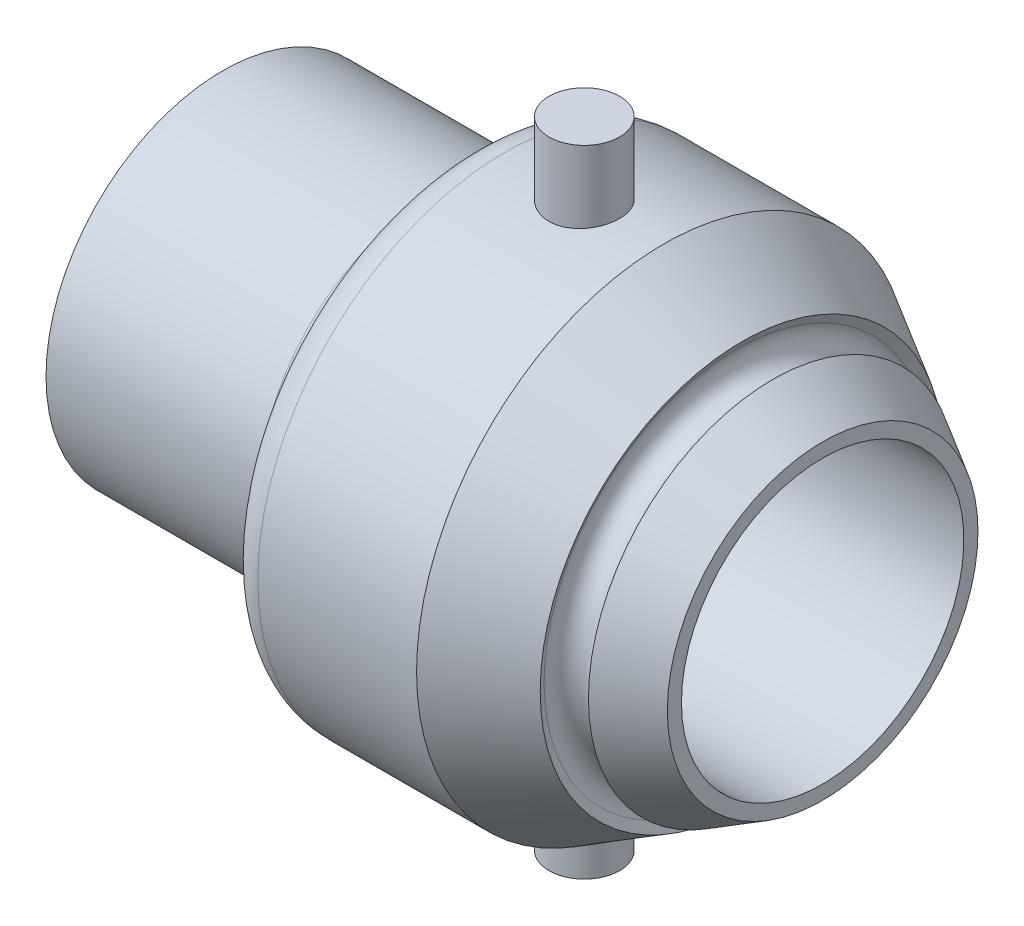
from build123d import *

# Parameters (mm, degrees)
SKETCH3_R                       = 25
SKETCH3_R_2                     = 20
BOSS_EXTRUDE2_DEPTH             = 35
FILLET1_R                       = 5
BOSS_EXTRUDE1_REACH             = 113.924
SKETCH2_R                       = 5
BOSS_EXTRUDE1_DIRECTION_2_DEPTH = 3


with BuildPart() as part:
    # Sketch1 → Revolve1 (revolve)
    with BuildSketch(Plane.XY, mode=Mode.PRIVATE) as revolve1_sk:
        with BuildLine():
            Line((-10.818024311, 35), (-38.301363812, 35))
            Line((-38.301363812, 35), (-38.301363812, 20))
            Line((-38.301363812, 20), (11.698636188, 20))
            Line((11.698636188, 20), (11.698636188, 22))
            Line((11.698636188, 22), (4.613699697, 26.09048999))
            Line((4.613699697, 26.09048999), (3.863699697, 24.791451884))
            ThreePointArc((3.863699697, 24.791451884), (0.448636188, 23.876388375), (-0.466427322, 27.291451884))
            Line((-0.466427322, 27.291451884), (0.283572678, 28.59048999))
            Line((0.283572678, 28.59048999), (-10.818024311, 35))
        make_face()
    revolve(revolve1_sk.sketch.rotate(Axis((-10.823091425, 0, 0), (1, 0, 0)), 90), axis=Axis((-10.823091425, 0, 0), (1, 0, 0)))

    # Sketch3 → Boss-Extrude2 (add)
    with BuildSketch(Plane.ZY.offset(38.301363812)):
        with Locations(Location((0, 0, 0), (0, 0, 180))):
            Circle(SKETCH3_R)
        Circle(SKETCH3_R_2, mode=Mode.SUBTRACT)
    extrude(amount=BOSS_EXTRUDE2_DEPTH)

    # Fillet1
    fillet1_edges = [part.edges().sort_by_distance(p)[0] for p in [
        (-38.301363812, 0, 25),
        (-38.301363812, 0, -35),
    ]]
    fillet(fillet1_edges, radius=FILLET1_R - 0.0001)  # a hair under: the kernel refuses the full size

    # Sketch2 → Boss-Extrude1 (add, up to next)
    with BuildSketch(Plane(origin=(0, 42, 0), x_dir=(1, 0, 0), z_dir=(0, 1, 0)), mode=Mode.PRIVATE) as boss_extrude1_sk1:
        with Locations(Location((-22.059694062, 0, 0), (0, 0, 90))):
            Circle(SKETCH2_R)
    boss_extrude1_tool1 = extrude(boss_extrude1_sk1.sketch, amount=-BOSS_EXTRUDE1_REACH, mode=Mode.PRIVATE) - part.part
    boss_extrude1 = boss_extrude1_tool1.solids().sort_by_distance((-22.059694, 42, 0))[0]
    add(boss_extrude1)

    # Sketch2 → Boss-Extrude1 direction 2 (add)
    with BuildSketch(Plane(origin=(0, 42, 0), x_dir=(1, 0, 0), z_dir=(0, 1, 0))):
        with Locations(Location((-22.059694062, 0, 0), (0, 0, 90))):
            Circle(SKETCH2_R)
    boss_extrude1_direction_2 = extrude(amount=BOSS_EXTRUDE1_DIRECTION_2_DEPTH)

    # Mirror1: Boss-Extrude1, Boss-Extrude1 direction 2 across plane
    add(boss_extrude1.mirror(Plane.ZX))
    add(boss_extrude1_direction_2.mirror(Plane.ZX))


solid = part.part
